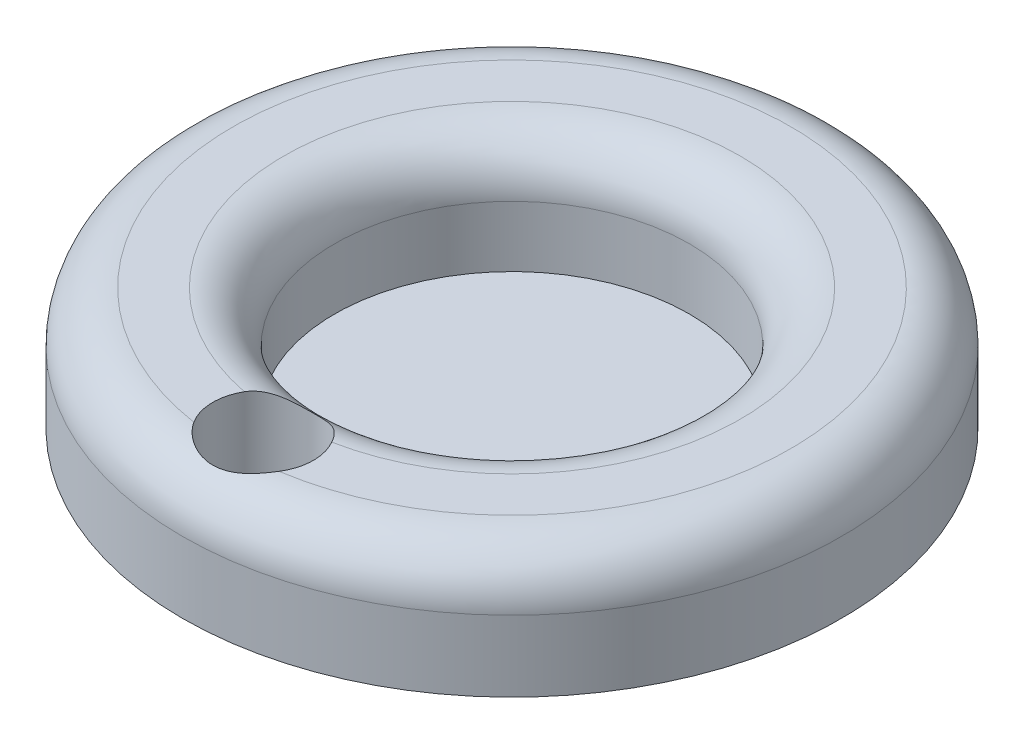
from build123d import *

# Parameters (mm, degrees)
CROQUIS1_R              = 32.5
CROQUIS1_R_2            = 4.96
SALIENTE_EXTRUIR1_DEPTH = 12
CROQUIS2_R              = 17.5
CORTAR_EXTRUIR1_DEPTH   = 11
REDONDEO4_R             = 5
REDONDEO5_R             = 5


with BuildPart() as part:
    # Croquis1 → Saliente-Extruir1 (new body)
    with BuildSketch(Plane(origin=(0, 0, 0), x_dir=(1, 0, 0), z_dir=(0, 1, 0))):
        with Locations(Location((0, 0, 0), (0, 0, 270))):
            Circle(CROQUIS1_R)
        with Locations(Location((0, -24.54, 0), (0, 0, 270))):
            Circle(CROQUIS1_R_2, mode=Mode.SUBTRACT)
    extrude(amount=SALIENTE_EXTRUIR1_DEPTH)

    # Croquis2 → Cortar-Extruir1 (cut)
    with BuildSketch(Plane(origin=(0, 12, 0), x_dir=(1, 0, 0), z_dir=(0, 1, 0))):
        with Locations(Location((0, 0, 0), (0, 0, 270))):
            Circle(CROQUIS2_R)
    extrude(amount=-CORTAR_EXTRUIR1_DEPTH, mode=Mode.SUBTRACT)

    # Redondeo4
    # the kernel refuses this fillet: 5 mm, written as the material it takes off along each edge
    with BuildSketch(Plane(origin=(0, 12, 0), x_dir=(0, 0, 1), z_dir=(-1, 0, 0))) as redondeo4_piece_1:
        with BuildLine():
            CenterArc((32.5 - REDONDEO4_R, -REDONDEO4_R), REDONDEO4_R, 0, 90)
            Line((32.5 - REDONDEO4_R, 0), (32.5, 0))
            Line((32.5, 0), (32.5, -REDONDEO4_R))
        make_face()
    revolve(axis=Axis((0, 12, 0), (0, 1, 0)), mode=Mode.SUBTRACT)

    # Redondeo5
    # the kernel refuses this fillet: 5 mm, written as the material it takes off along each edge
    with BuildSketch(Plane(origin=(0, 12, 0), x_dir=(0, 0, 1), z_dir=(-1, 0, 0))) as redondeo5_piece_1:
        with BuildLine():
            CenterArc((17.5 + REDONDEO5_R, -REDONDEO5_R), REDONDEO5_R, 90, 90)
            Line((17.5, -REDONDEO5_R), (17.5, 0))
            Line((17.5, 0), (17.5 + REDONDEO5_R, 0))
        make_face()
    revolve(axis=Axis((0, 12, 0), (0, 1, 0)), mode=Mode.SUBTRACT)


solid = part.part
